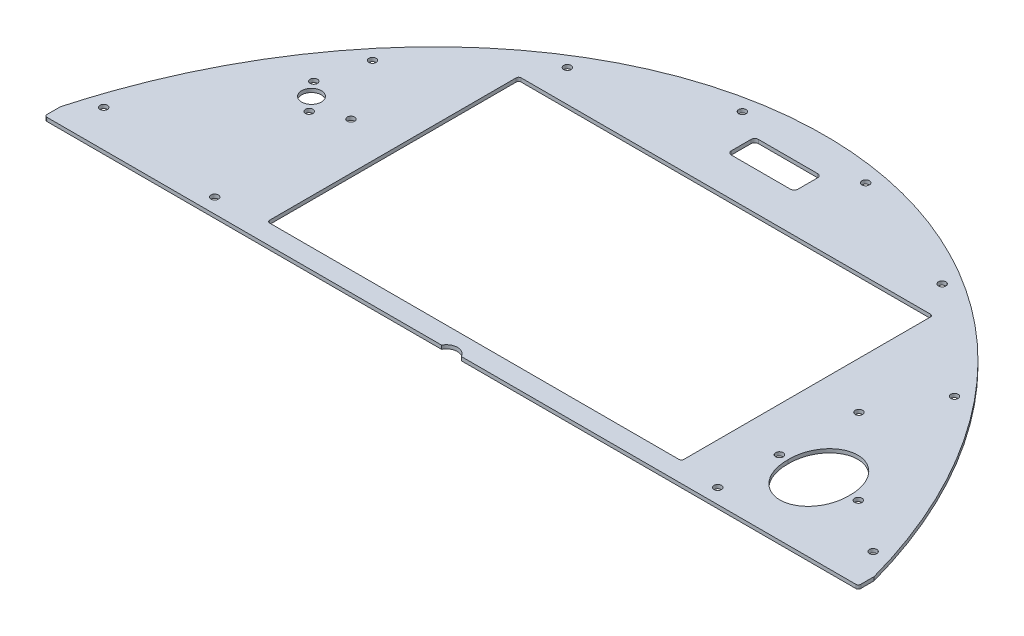
from build123d import *

# Parameters (mm, degrees)
BOSS_EXTRU_1_DEPTH      = 1.5
ESQUISSE4_R             = 4
ESQUISSE4_R_2           = 1.5
ESQUISSE4_W             = 168
ESQUISSE4_H             = 102
ENL_V_MAT_EXTRU_3_DEPTH = 3
ENL_V_MAT_EXTRU_4_DEPTH = 1.5
ESQUISSE11_R            = 1.5
ENL_V_MAT_EXTRU_5_DEPTH = 1.5
CONG_1_R                = 1
ESQUISSE12_R            = 1.5
ENL_V_MAT_EXTRU_6_DEPTH = 224.924001117
ESQUISSE14_W            = 27
ESQUISSE14_H            = 11
ENL_V_MAT_EXTRU_7_DEPTH = 1.5
CONG_2_R                = 1.5


# Read off the part's stored shape, not the designer's step: Enlèv. mat.-Extru.4
with BuildPart() as part:
    # Esquisse1 → Boss.-Extru.1 (new body)
    with BuildSketch(Plane(origin=(0, 0, 0), x_dir=(1, 0, 0), z_dir=(0, 1, 0))):
        with BuildLine():
            Line((-165, 6.391802297), (-165, 0))
            Line((-165, 0), (165, 0))
            Line((165, 0), (165, 6.391802297))
            add(Edge.make_bspline(
                [(165, 6.391802297), (0, 608.094924715), (-165, 6.391802297)],
                knots=[1.893832827, 1.893832827, 1.893832827, 4.38935248, 4.38935248, 4.38935248], degree=2, weights=[1, 0.317447459, 1]))
        make_face()
    extrude(amount=BOSS_EXTRU_1_DEPTH)

    # Esquisse4 → Enlèv. mat.-Extru.3 (cut)
    with BuildSketch(Plane(origin=(0, 1.5, 0), x_dir=(1, 0, 0), z_dir=(0, 1, 0))):
        with Locations(Location((-117.74, 61, 0), (0, 0, 270))):
            Circle(ESQUISSE4_R)
        with Locations(Location((-112.919092927, 55.254666677, 0), (0, 0, 270))):
            Circle(ESQUISSE4_R_2)
        with Locations(Location((-122.560907073, 66.745333323, 0), (0, 0, 270))):
            Circle(ESQUISSE4_R_2)
        with Locations(Location((-101.74, 61, 0), (0, 0, 270))):
            Circle(ESQUISSE4_R_2)
        with Locations(Location((104.26, 61, 0), (0, 0, 270))):
            Circle(ESQUISSE4_R_2)
        with Locations((1.26, 59)):
            Rectangle(ESQUISSE4_W, ESQUISSE4_H)
    extrude(amount=-ENL_V_MAT_EXTRU_3_DEPTH, mode=Mode.SUBTRACT)

    # Enlèv. mat.-Extru.4 outline → Enlèv. mat.-Extru.4 (cut)
    with BuildSketch(Plane(origin=(0, 0, 0), x_dir=(1, 0, 0), z_dir=(0, 1, 0))):
        with BuildLine():
            add(Edge.make_bspline(
                [(131.492595534, 29.994209065), (131.937846155, 45.779047079), (119, 45.779047079), (106.062153845, 45.779047079), (106.507404466, 29.994209065)],
                knots=[1.536374944, 1.536374944, 1.536374944, 3.141592654, 3.141592654, 4.746810363, 4.746810363, 4.746810363], degree=2, weights=[1, 0.694832863, 1, 0.694832863, 1]))
            add(Edge.make_bspline(
                [(106.507404466, 29.994209065), (106.062153845, 14.209371052), (119, 14.209371052), (131.937846155, 14.209371052), (131.492595534, 29.994209065)],
                knots=[4.677967597, 4.677967597, 4.677967597, 6.283185307, 6.283185307, 7.888403017, 7.888403017, 7.888403017], degree=2, weights=[1, 0.694832863, 1, 0.694832863, 1]))
        make_face()
    extrude(amount=ENL_V_MAT_EXTRU_4_DEPTH, mode=Mode.SUBTRACT)

    # Esquisse11 → Enlèv. mat.-Extru.5 (cut)
    with BuildSketch(Plane(origin=(0, 1.5, 0), x_dir=(1, 0, 0), z_dir=(0, 1, 0))):
        with Locations(Location((103, 29.994209065, 0), (0, 0, 270))):
            Circle(ESQUISSE11_R)
        with Locations(Location((135, 29.994209065, 0), (0, 0, 90))):
            Circle(ESQUISSE11_R)
    extrude(amount=-ENL_V_MAT_EXTRU_5_DEPTH, mode=Mode.SUBTRACT)

    # Congé1
    cong_1_edges = [part.edges().sort_by_distance(p)[0] for p in [
        (-82.74, 0.75, -110),
        (-82.74, 0.75, -8),
        (85.26, 0.75, -8),
        (85.26, 0.75, -110),
        (165, 0.75, 0),
        (-165, 0.75, 0),
    ]]
    fillet(cong_1_edges, radius=CONG_1_R)

    # Esquisse12 → Enlèv. mat.-Extru.6 (cut, through all)
    with BuildSketch(Plane(origin=(0, 1.5, 0), x_dir=(1, 0, 0), z_dir=(0, 1, 0))):
        with Locations(Location((-156, 15, 0), (0, 0, 270))):
            Circle(ESQUISSE12_R)
        with Locations(Location((-76, 123, 0), (0, 0, 270))):
            Circle(ESQUISSE12_R)
        with Locations(Location((-25, 143, 0), (0, 0, 270))):
            Circle(ESQUISSE12_R)
        with Locations(Location((25, 143, 0), (0, 0, 270))):
            Circle(ESQUISSE12_R)
        with Locations(Location((76, 123, 0), (0, 0, 270))):
            Circle(ESQUISSE12_R)
        with Locations(Location((156, 15, 0), (0, 0, 270))):
            Circle(ESQUISSE12_R)
        with Locations(Location((-102, 6, 0), (0, 0, 270))):
            Circle(ESQUISSE12_R)
        with Locations(Location((102, 6, 0), (0, 0, 270))):
            Circle(ESQUISSE12_R)
        with Locations(Location((-118, 86, 0), (0, 0, 270))):
            Circle(ESQUISSE12_R)
        with Locations(Location((118, 86, 0), (0, 0, 270))):
            Circle(ESQUISSE12_R)
        with BuildLine():
            Line((-4, 0), (4, 0))
            ThreePointArc((4, 0), (0, 2.438447187), (-4, 0))
        make_face()
    extrude(amount=-ENL_V_MAT_EXTRU_6_DEPTH, mode=Mode.SUBTRACT)

    # Esquisse14 → Enlèv. mat.-Extru.7 (cut)
    with BuildSketch(Plane(origin=(0, 1.5, 0), x_dir=(1, 0, 0), z_dir=(0, 1, 0))):
        with Locations((0, 131)):
            Rectangle(ESQUISSE14_W, ESQUISSE14_H)
    extrude(amount=-ENL_V_MAT_EXTRU_7_DEPTH, mode=Mode.SUBTRACT)

    # Congé2
    cong_2_edges = [part.edges().sort_by_distance(p)[0] for p in [
        (-13.5, 0.75, -125.5),
        (-13.5, 0.75, -136.5),
        (13.5, 0.75, -136.5),
        (13.5, 0.75, -125.5),
    ]]
    fillet(cong_2_edges, radius=CONG_2_R)


solid = part.part
